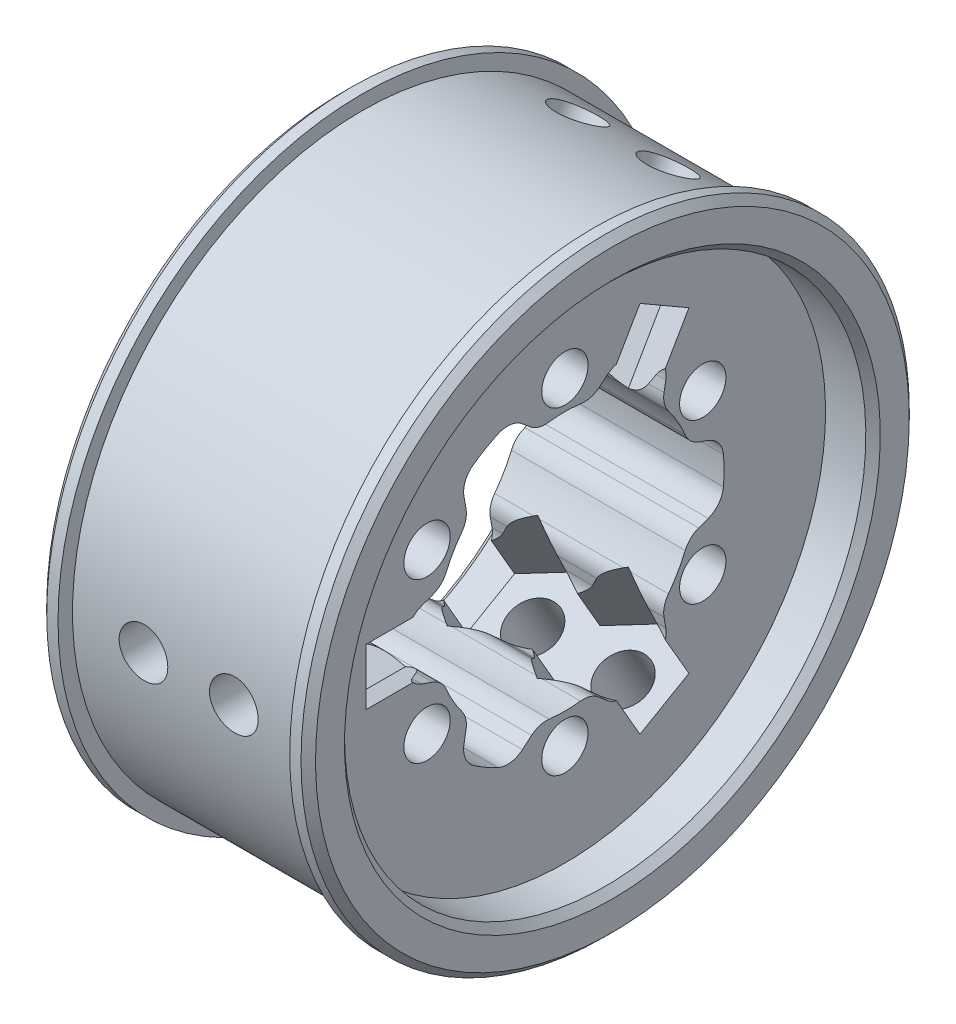
from build123d import *

# Parameters (mm, degrees)
SKETCH2_R           = 2.54
CUT_EXTRUDE3_DEPTH  = 56.595909099
SKETCH3_R           = 28.575
CUT_EXTRUDE4_DEPTH  = 5.207
SKETCH4_R           = 22.86
CUT_EXTRUDE5_DEPTH  = 5.207
CHAMFER1_SIZE       = 0.79375
CUT_EXTRUDE6_START  = -5.08
CUT_EXTRUDE6_DEPTH  = 9.525
SKETCH10_R          = 2.667
CUT_EXTRUDE9_DEPTH  = 67.117778807
CIRPATTERN2_COUNT   = 3
SKETCH11_R          = 1.0922
CUT_EXTRUDE10_DEPTH = 67.761937332


with BuildPart() as part:
    # Sketch1 → Revolve1 (revolve)
    with BuildSketch(Plane.XY):
        Polygon((0, 0), (0, 31.75), (12.7, 31.75), (12.7, 33.3375), (14.732, 33.3375), (14.732, 0), align=None)
    revolve1 = revolve(axis=Axis((14.732, 0, 0), (-1, 0, 0)))

    # Mirror3: Revolve1 across plane
    add(revolve1.mirror(Plane.ZY))

    # Sketch2 → Cut-Extrude3 (cut, through all)
    with BuildSketch(Plane(origin=(14.732, 0, 0), x_dir=(0, 0, -1), z_dir=(1, 0, 0))):
        with Locations((0, 17.4498)):
            Circle(SKETCH2_R)
        with Locations((15.111970091, 8.7249)):
            Circle(SKETCH2_R)
        with Locations((15.111970091, -8.7249)):
            Circle(SKETCH2_R)
        with Locations((0, -17.4498)):
            Circle(SKETCH2_R)
        with Locations((-15.111970091, -8.7249)):
            Circle(SKETCH2_R)
        with Locations((-15.111970091, 8.7249)):
            Circle(SKETCH2_R)
        with BuildLine():
            Line((14.665568358, 4.08236111), (15.720738661, 3.698310528))
            ThreePointArc((15.720738661, 3.698310528), (16.866499311, 2.858560348), (17.382162096, 1.534913975))
            ThreePointArc((17.382162096, 1.534913975), (17.4498, 0), (17.382162096, -1.534913975))
            ThreePointArc((17.382162096, -1.534913975), (16.866499311, -2.858560348), (15.720738661, -3.698310528))
            Line((15.720738661, -3.698310528), (14.665568358, -4.08236111))
            ThreePointArc((14.665568358, -4.08236111), (13.779603056, -4.632705397), (13.189499594, -5.492700312))
            ThreePointArc((13.189499594, -5.492700312), (12.373337957, -7.14375), (11.351567802, -8.676091556))
            ThreePointArc((11.351567802, -8.676091556), (10.90184209, -9.617133602), (10.868212608, -10.659574204))
            Line((10.868212608, -10.659574204), (11.063200199, -11.765403783))
            ThreePointArc((11.063200199, -11.765403783), (10.908835536, -13.177536702), (10.020355543, -14.28593696))
            ThreePointArc((10.020355543, -14.28593696), (8.7249, -15.111970091), (7.361806553, -15.820850935))
            ThreePointArc((7.361806553, -15.820850935), (5.957663775, -16.03609705), (4.657538462, -15.46371431))
            Line((4.657538462, -15.46371431), (3.648569587, -14.617088899))
            ThreePointArc((3.648569587, -14.617088899), (2.738575306, -14.127821336), (1.709006412, -14.041448709))
            ThreePointArc((1.709006412, -14.041448709), (0, -14.145069274), (-1.709006412, -14.041448709))
            ThreePointArc((-1.709006412, -14.041448709), (-2.738575306, -14.127821336), (-3.648569587, -14.617088899))
            Line((-3.648569587, -14.617088899), (-4.657538462, -15.46371431))
            ThreePointArc((-4.657538462, -15.46371431), (-5.957663775, -16.03609705), (-7.361806553, -15.820850935))
            ThreePointArc((-7.361806553, -15.820850935), (-8.7249, -15.111970091), (-10.020355543, -14.28593696))
            ThreePointArc((-10.020355543, -14.28593696), (-10.908835536, -13.177536702), (-11.063200199, -11.765403783))
            Line((-11.063200199, -11.765403783), (-10.834485523, -10.468298399))
            ThreePointArc((-10.834485523, -10.468298399), (-10.865764524, -9.435586453), (-11.305748082, -8.500767323))
            ThreePointArc((-11.305748082, -8.500767323), (-12.249989329, -7.072534637), (-13.014754494, -5.540681386))
            ThreePointArc((-13.014754494, -5.540681386), (-13.60433983, -4.692234882), (-14.483055109, -4.1487905))
            Line((-14.483055109, -4.1487905), (-15.720738661, -3.698310528))
            ThreePointArc((-15.720738661, -3.698310528), (-16.866499311, -2.858560348), (-17.382162096, -1.534913975))
            ThreePointArc((-17.382162096, -1.534913975), (-17.4498, 0), (-17.382162096, 1.534913975))
            ThreePointArc((-17.382162096, 1.534913975), (-16.866499311, 2.858560348), (-15.720738661, 3.698310528))
            Line((-15.720738661, 3.698310528), (-14.483055109, 4.1487905))
            ThreePointArc((-14.483055109, 4.1487905), (-13.60433983, 4.692234882), (-13.014754494, 5.540681386))
            ThreePointArc((-13.014754494, 5.540681386), (-12.249989329, 7.072534637), (-11.305748082, 8.500767323))
            ThreePointArc((-11.305748082, 8.500767323), (-10.865764524, 9.435586453), (-10.834485523, 10.468298399))
            Line((-10.834485523, 10.468298399), (-11.063200199, 11.765403783))
            ThreePointArc((-11.063200199, 11.765403783), (-10.908835536, 13.177536702), (-10.020355543, 14.28593696))
            ThreePointArc((-10.020355543, 14.28593696), (-8.7249, 15.111970091), (-7.361806553, 15.820850935))
            ThreePointArc((-7.361806553, 15.820850935), (-5.957663775, 16.03609705), (-4.657538462, 15.46371431))
            Line((-4.657538462, 15.46371431), (-3.79735575, 14.741935314))
            ThreePointArc((-3.79735575, 14.741935314), (-2.877760966, 14.249838999), (-1.837931792, 14.168791867))
            ThreePointArc((-1.837931792, 14.168791867), (0, 14.2875), (1.837931792, 14.168791867))
            ThreePointArc((1.837931792, 14.168791867), (2.877760966, 14.249838999), (3.79735575, 14.741935314))
            Line((3.79735575, 14.741935314), (4.657538462, 15.46371431))
            ThreePointArc((4.657538462, 15.46371431), (5.957663775, 16.03609705), (7.361806553, 15.820850935))
            ThreePointArc((7.361806553, 15.820850935), (8.7249, 15.111970091), (10.020355543, 14.28593696))
            ThreePointArc((10.020355543, 14.28593696), (10.908835536, 13.177536702), (11.063200199, 11.765403783))
            Line((11.063200199, 11.765403783), (10.868212608, 10.659574204))
            ThreePointArc((10.868212608, 10.659574204), (10.90184209, 9.617133602), (11.351567802, 8.676091556))
            ThreePointArc((11.351567802, 8.676091556), (12.373337957, 7.14375), (13.189499594, 5.492700312))
            ThreePointArc((13.189499594, 5.492700312), (13.779603056, 4.632705397), (14.665568358, 4.08236111))
        make_face()
    extrude(amount=-CUT_EXTRUDE3_DEPTH, mode=Mode.SUBTRACT)

    # Sketch3 → Cut-Extrude4 (cut)
    with BuildSketch(Plane(origin=(14.732, 0, 0), x_dir=(0, 0, -1), z_dir=(1, 0, 0))):
        Circle(SKETCH3_R)
    extrude(amount=-CUT_EXTRUDE4_DEPTH, mode=Mode.SUBTRACT)

    # Sketch4 → Cut-Extrude5 (cut)
    with BuildSketch(Plane.ZY.offset(14.732)):
        Circle(SKETCH4_R)
    extrude(amount=-CUT_EXTRUDE5_DEPTH, mode=Mode.SUBTRACT)

    # Chamfer1
    chamfer1_edges = [part.edges().sort_by_distance(p)[0] for p in [
        (-14.732, 0, -22.86),
        (-14.732, -33.3375, 0),
        (14.732, -33.3375, 0),
        (14.732, 0, 28.575),
    ]]
    chamfer(chamfer1_edges, length=CHAMFER1_SIZE)

    # Sketch7 → Cut-Extrude6 (cut)
    with BuildSketch(Plane.XY.offset(17.382162096).offset(CUT_EXTRUDE6_START)):
        Polygon((-4.92125, 5.682570024), (-9.8425, 2.841285012), (-9.8425, -2.841285012), (-4.92125, -5.682570024), (0, -2.841285012), (4.98475, -5.719231767), (9.93775, -2.859615883), (9.93775, 2.859615883), (4.98475, 5.719231767), (0, 2.841285012), align=None)
    cut_extrude6 = extrude(amount=CUT_EXTRUDE6_DEPTH, mode=Mode.SUBTRACT)

    # Sketch10 → Cut-Extrude9 (cut, through all)
    with BuildSketch(Plane(origin=(0, 0, 21.827162096), x_dir=(-1, 0, 0), z_dir=(0, 0, -1))):
        with Locations((-4.98475, 0)):
            Circle(SKETCH10_R)
        with Locations((4.92125, 0)):
            Circle(SKETCH10_R)
    cut_extrude9 = extrude(amount=-CUT_EXTRUDE9_DEPTH, mode=Mode.SUBTRACT)

    # CirPattern2: Cut-Extrude6, Cut-Extrude9 ×3 about axis
    cirpattern2_axis = Axis((12.7, 0, 0), (1, 0, 0))
    add([cut_extrude6.rotate(cirpattern2_axis, i * 360 / CIRPATTERN2_COUNT) for i in range(1, CIRPATTERN2_COUNT)], mode=Mode.SUBTRACT)
    add([cut_extrude9.rotate(cirpattern2_axis, i * 360 / CIRPATTERN2_COUNT) for i in range(1, CIRPATTERN2_COUNT)], mode=Mode.SUBTRACT)

    # Sketch11 → Cut-Extrude10 (cut, through all)
    with BuildSketch(Plane(origin=(0, -21.287249995, -2.106274352), x_dir=(1, 0, 0), z_dir=(0, 0.8660254037844386, -0.5000000000000002))):
        with Locations((-7.9375, -6.117712094)):
            Circle(SKETCH11_R)
        with Locations((-7.9375, -18.817712094)):
            Circle(SKETCH11_R)
        with Locations((7.9375, -18.817712094)):
            Circle(SKETCH11_R)
        with Locations((7.9375, -6.117712094)):
            Circle(SKETCH11_R)
    extrude(amount=-CUT_EXTRUDE10_DEPTH, mode=Mode.SUBTRACT)


solid = part.part
